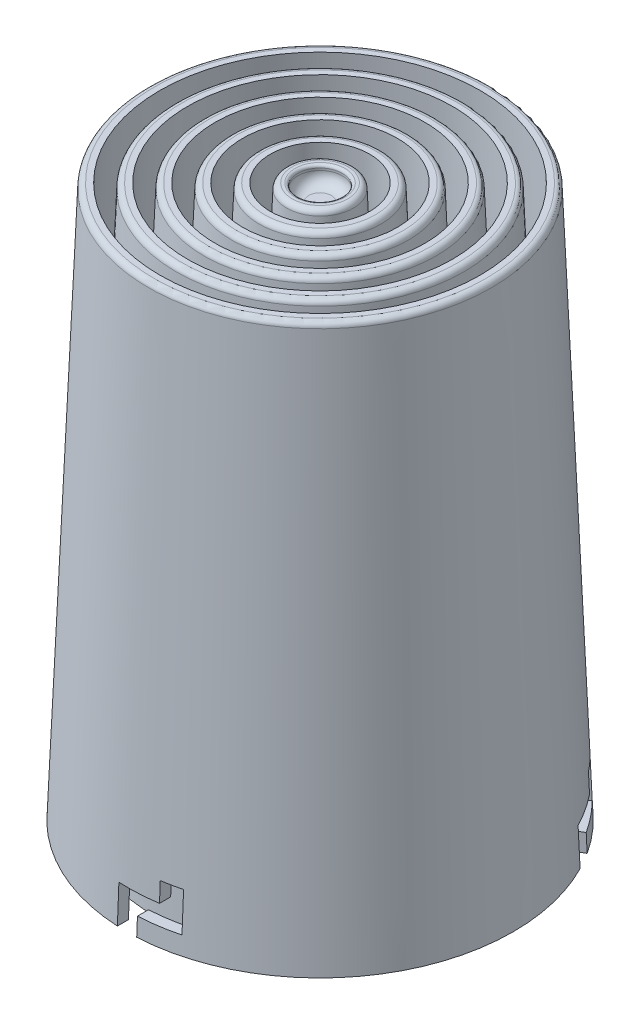
from build123d import *

# Parameters (mm, degrees)
CUT_EXTRUDE_START        = 30
CUT_EXTRUDE_2_DEPTH      = 6
PATTERN_CIRCULAR_1_COUNT = 3


with BuildPart() as part:
    # Эскиз6 → Повернуть1 (revolve)
    with BuildSketch(Plane.XY, mode=Mode.PRIVATE) as revolve_1_sk:
        with BuildLine():
            Line((-35, 0), (-31.038401278, 99.039968038))
            ThreePointArc((-31.038401278, 99.039968038), (-30.732032176, 99.721099174), (-30.03920032, 100))
            Line((-30.03920032, 100), (-29, 100))
            Line((-29, 100), (-33, 0))
            Line((-33, 0), (-35, 0))
        make_face()
        with BuildLine():
            Line((-24, 100), (-28, 0))
            Line((-28, 0), (-30, 0))
            Line((-30, 0), (-26.038401278, 99.039968038))
            ThreePointArc((-26.038401278, 99.039968038), (-25.732032176, 99.721099174), (-25.03920032, 100))
            Line((-25.03920032, 100), (-24, 100))
        make_face()
        with BuildLine():
            Line((-19, 100), (-23, 0))
            Line((-23, 0), (-25, 0))
            Line((-25, 0), (-21.038401278, 99.039968038))
            ThreePointArc((-21.038401278, 99.039968038), (-20.732032176, 99.721099174), (-20.03920032, 100))
            Line((-20.03920032, 100), (-19, 100))
        make_face()
        with BuildLine():
            Line((-14, 100), (-18, 0))
            Line((-18, 0), (-20, 0))
            Line((-20, 0), (-16.038401278, 99.039968038))
            ThreePointArc((-16.038401278, 99.039968038), (-15.732032176, 99.721099174), (-15.03920032, 100))
            Line((-15.03920032, 100), (-14, 100))
        make_face()
        with BuildLine():
            Line((-9, 100), (-13, 0))
            Line((-13, 0), (-15, 0))
            Line((-15, 0), (-11.038401278, 99.039968038))
            ThreePointArc((-11.038401278, 99.039968038), (-10.732032176, 99.721099174), (-10.03920032, 100))
            Line((-10.03920032, 100), (-9, 100))
        make_face()
        with BuildLine():
            Line((-4.020799361, 99.480015981), (-4.036802557, 99.079936077))
            ThreePointArc((-4.036802557, 99.079936077), (-3.480598988, 97.614336288), (-2.038400639, 97))
            Line((-2.038400639, 97), (0, 97))
            Line((0, 97), (0, 95))
            Line((0, 95), (-2.278400639, 95))
            ThreePointArc((-2.278400639, 95), (-3.664064352, 94.442198349), (-4.276802557, 93.079936077))
            Line((-4.276802557, 93.079936077), (-8, 0))
            Line((-8, 0), (-10, 0))
            Line((-10, 0), (-6.038401278, 99.039968038))
            ThreePointArc((-6.038401278, 99.039968038), (-5.732032176, 99.721099174), (-5.03920032, 100))
            Line((-5.03920032, 100), (-4.52039984, 100))
            ThreePointArc((-4.52039984, 100), (-4.159850253, 99.846415928), (-4.020799361, 99.480015981))
        make_face()
    revolve(revolve_1_sk.sketch.rotate(Axis((0, 0, 0), (0, 1, 0)), 180), axis=Axis((0, 0, 0), (0, 1, 0)))

    # Вырез-Вытянуть2: read off the stored shape, not the designer's step
    # Вырез-Вытянуть2 outline → Вырез-Вытянуть2 (cut)
    with BuildSketch(Plane.XY.offset(CUT_EXTRUDE_START)):
        Polygon((1.75, 0), (1.75, 3.25), (8.75, 3.25), (8.75, 10.25), (5.25, 10.25), (5.25, 6.75), (-1.75, 6.75), (-1.75, 0), align=None)
    cut_extrude_2 = extrude(amount=CUT_EXTRUDE_2_DEPTH, mode=Mode.SUBTRACT)

    # Круговой массив1: Вырез-Вытянуть2 ×3 about axis
    pattern_circular_1_axis = Axis((0, 0, 0), (0, 1, 0))
    for i in range(1, PATTERN_CIRCULAR_1_COUNT):
        add(cut_extrude_2.rotate(pattern_circular_1_axis, i * 360 / PATTERN_CIRCULAR_1_COUNT), mode=Mode.SUBTRACT)


solid = part.part
